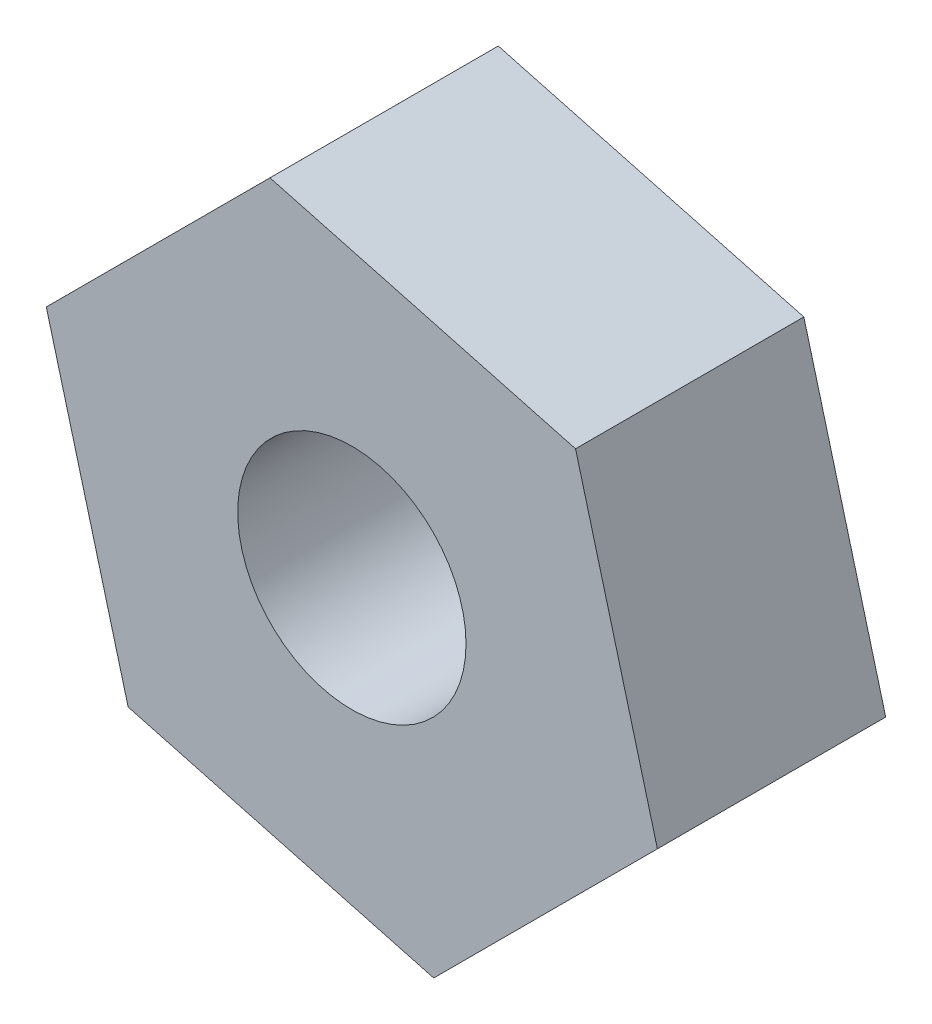
from build123d import *

# Parameters (mm, degrees)
CROQUIS1_R              = 6
CROQUIS1_R_2            = 2.5
SALIENTE_EXTRUIR1_DEPTH = 5
SALIENTE_EXTRUIR2_START = -5
CROQUIS2_R              = 2.5
SALIENTE_EXTRUIR2_DEPTH = 5


with BuildPart() as part:
    # Croquis1 → Saliente-Extruir1 (new body)
    with BuildSketch(Plane.XY):
        Circle(CROQUIS1_R)
        Circle(CROQUIS1_R_2, mode=Mode.SUBTRACT)
    extrude(amount=SALIENTE_EXTRUIR1_DEPTH)

    # Croquis2 → Saliente-Extruir2 (add)
    with BuildSketch(Plane.XY.offset(5).offset(SALIENTE_EXTRUIR2_START)):
        Polygon((-6.692111353, 1.79322214), (-1.793079748, 6.692149506), (4.899031604, 4.898927366), (6.692111353, -1.79322214), (1.793079748, -6.692149506), (-4.899031604, -4.898927366), align=None)
        Circle(CROQUIS2_R, mode=Mode.SUBTRACT)
    extrude(amount=SALIENTE_EXTRUIR2_DEPTH)


solid = part.part
